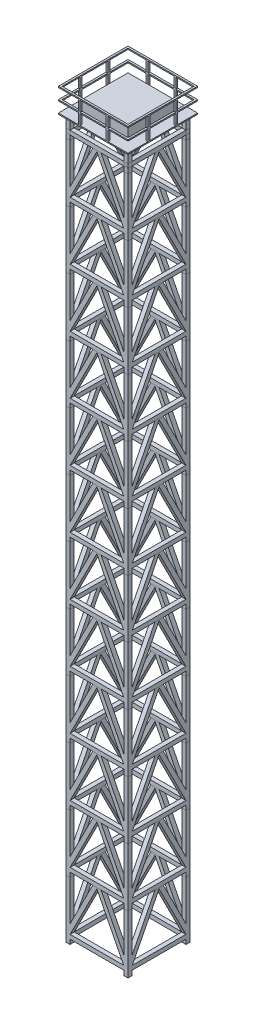
from build123d import *

# Parameters (mm, degrees)
SKETCH1_W                   = 180
SKETCH1_H                   = 180
BOSS_EXTRUDE1_DEPTH         = 2500
SKETCH2_W                   = 180
SKETCH2_H                   = 180
BOSS_EXTRUDE2_DEPTH         = 2320
BOSS_EXTRUDE3_DEPTH         = 180
CIRPATTERN4_COUNT           = 4
LPATTERN1_COUNT             = 12
LPATTERN1_PITCH             = 2500
SKETCH4_W                   = 180
SKETCH4_H                   = 180
BOSS_EXTRUDE4_DEPTH         = 200
SKETCH5_W                   = 2680
SKETCH5_H                   = 180
BOSS_EXTRUDE5_DEPTH         = 180
SKETCH6_W                   = 180
SKETCH6_H                   = 180
BOSS_EXTRUDE6_DEPTH         = 500
CIRPATTERN8_COUNT           = 4
SKETCH7_W                   = 3000
SKETCH7_H                   = 3000
BOSS_EXTRUDE7_DEPTH         = 50
SKETCH8_W                   = 2000
SKETCH8_H                   = 2000
BOSS_EXTRUDE8_DEPTH         = 500
SKETCH9_W                   = 80
SKETCH9_H                   = 80
BOSS_EXTRUDE9_DEPTH         = 1000
SKETCH10_W                  = 80
SKETCH10_H                  = 3000
BOSS_EXTRUDE10_DEPTH        = 50
LPATTERN2_COUNT             = 2
LPATTERN2_PITCH             = 500
CIRPATTERN9_COUNT           = 4
CIRPATTERN9_COPY_1_SKETCH_W = 80
CIRPATTERN9_COPY_1_SKETCH_H = 80
CIRPATTERN9_COPY_1_DEPTH    = 1000
CIRPATTERN9_COPY_2_SKETCH_W = 80
CIRPATTERN9_COPY_2_SKETCH_H = 80
CIRPATTERN9_COPY_2_DEPTH    = 1000
CIRPATTERN9_COPY_3_SKETCH_W = 80
CIRPATTERN9_COPY_3_SKETCH_H = 80
CIRPATTERN9_COPY_3_DEPTH    = 1000
CIRPATTERN9_COPY_4_SKETCH_W = 80
CIRPATTERN9_COPY_4_SKETCH_H = 3000
CIRPATTERN9_COPY_4_DEPTH    = 50
CIRPATTERN9_COPY_5_SKETCH_W = 80
CIRPATTERN9_COPY_5_SKETCH_H = 3000
CIRPATTERN9_COPY_5_DEPTH    = 50
CIRPATTERN9_COPY_6_SKETCH_W = 80
CIRPATTERN9_COPY_6_SKETCH_H = 3000
CIRPATTERN9_COPY_6_DEPTH    = 50


with BuildPart() as part:
    # Sketch1 → Boss-Extrude1 (new body)
    with BuildSketch(Plane(origin=(0, 0, 0), x_dir=(1, 0, 0), z_dir=(0, 1, 0))):
        with Locations((1250, -1250)):
            Rectangle(SKETCH1_W, SKETCH1_H)
    extrude(amount=BOSS_EXTRUDE1_DEPTH)

    # Sketch2 → Boss-Extrude2 (add)
    with BuildSketch(Plane.ZY.offset(-1160)):
        with Locations((1250, 290)):
            Rectangle(SKETCH2_W, SKETCH2_H)
    extrude(amount=BOSS_EXTRUDE2_DEPTH)

    # Sketch3 → Boss-Extrude3 (add)
    with BuildSketch(Plane.XY.offset(1340)):
        Polygon((1181.644275361, 325.25799865), (0, 2656.964152747), (0, 2700), (179.984850938, 2700), (1181.644275361, 723.453002788), align=None)
    boss_extrude3 = extrude(amount=-BOSS_EXTRUDE3_DEPTH)

    # Mirror2: Boss-Extrude3 across plane
    add(boss_extrude3.mirror(Plane(origin=(0, 0, 0), x_dir=(0, 0, 1), z_dir=(1, 0, 0))))


with BuildPart() as cirpattern4_1:
    # CirPattern4: pattern copy
    add(part.part.rotate(Axis((0, 0, 0), (0, 1, 0)), 1 * 360 / CIRPATTERN4_COUNT))


with BuildPart() as cirpattern4_2:
    # CirPattern4: pattern copy
    add(part.part.rotate(Axis((0, 0, 0), (0, 1, 0)), 2 * 360 / CIRPATTERN4_COUNT))


with BuildPart() as cirpattern4_3:
    # CirPattern4: pattern copy
    add(part.part.rotate(Axis((0, 0, 0), (0, 1, 0)), 3 * 360 / CIRPATTERN4_COUNT))


with BuildPart() as part_1:
    add(part.part)

    # Combine1: union CirPattern4_1, CirPattern4_2, CirPattern4_3
    add(cirpattern4_1.part)
    add(cirpattern4_2.part)
    add(cirpattern4_3.part)


with BuildPart() as lpattern1_1:
    # LPattern1: pattern copy
    add(part_1.part.moved(Location(Vector(0, 1, 0) * (1 * LPATTERN1_PITCH))))


with BuildPart() as lpattern1_2:
    # LPattern1: pattern copy
    add(part_1.part.moved(Location(Vector(0, 1, 0) * (2 * LPATTERN1_PITCH))))


with BuildPart() as lpattern1_3:
    # LPattern1: pattern copy
    add(part_1.part.moved(Location(Vector(0, 1, 0) * (3 * LPATTERN1_PITCH))))


with BuildPart() as lpattern1_4:
    # LPattern1: pattern copy
    add(part_1.part.moved(Location(Vector(0, 1, 0) * (4 * LPATTERN1_PITCH))))


with BuildPart() as lpattern1_5:
    # LPattern1: pattern copy
    add(part_1.part.moved(Location(Vector(0, 1, 0) * (5 * LPATTERN1_PITCH))))


with BuildPart() as lpattern1_6:
    # LPattern1: pattern copy
    add(part_1.part.moved(Location(Vector(0, 1, 0) * (6 * LPATTERN1_PITCH))))


with BuildPart() as lpattern1_7:
    # LPattern1: pattern copy
    add(part_1.part.moved(Location(Vector(0, 1, 0) * (7 * LPATTERN1_PITCH))))


with BuildPart() as lpattern1_8:
    # LPattern1: pattern copy
    add(part_1.part.moved(Location(Vector(0, 1, 0) * (8 * LPATTERN1_PITCH))))


with BuildPart() as lpattern1_9:
    # LPattern1: pattern copy
    add(part_1.part.moved(Location(Vector(0, 1, 0) * (9 * LPATTERN1_PITCH))))


with BuildPart() as lpattern1_10:
    # LPattern1: pattern copy
    add(part_1.part.moved(Location(Vector(0, 1, 0) * (10 * LPATTERN1_PITCH))))


with BuildPart() as lpattern1_11:
    # LPattern1: pattern copy
    add(part_1.part.moved(Location(Vector(0, 1, 0) * (11 * LPATTERN1_PITCH))))


with BuildPart() as body_13:
    # Sketch4 → Boss-Extrude4 (new body)
    with BuildSketch(Plane(origin=(0, 30000, 0), x_dir=(1, 0, 0), z_dir=(0, 1, 0))):
        with Locations((1250, -1250)):
            Rectangle(SKETCH4_W, SKETCH4_H)
    extrude(amount=BOSS_EXTRUDE4_DEPTH)


with BuildPart() as body_14:
    # Sketch5 → Boss-Extrude5 (new body)
    with BuildSketch(Plane(origin=(0, 30200, 0), x_dir=(1, 0, 0), z_dir=(0, 1, 0))):
        with Locations((0, -1250)):
            Rectangle(SKETCH5_W, SKETCH5_H)
    extrude(amount=BOSS_EXTRUDE5_DEPTH)


with BuildPart() as body_15:
    # Sketch6 → Boss-Extrude6 (new body)
    with BuildSketch(Plane(origin=(0, 30380, 0), x_dir=(1, 0, 0), z_dir=(0, 1, 0))):
        with Locations((1250, -1250)):
            Rectangle(SKETCH6_W, SKETCH6_H)
    extrude(amount=BOSS_EXTRUDE6_DEPTH)


with BuildPart() as cirpattern8_1:
    # CirPattern8: pattern copy
    add(body_14.part.rotate(Axis((0, 0, 0), (0, 1, 0)), 1 * 360 / CIRPATTERN8_COUNT))


with BuildPart() as cirpattern8_2:
    # CirPattern8: pattern copy
    add(body_14.part.rotate(Axis((0, 0, 0), (0, 1, 0)), 2 * 360 / CIRPATTERN8_COUNT))


with BuildPart() as cirpattern8_3:
    # CirPattern8: pattern copy
    add(body_14.part.rotate(Axis((0, 0, 0), (0, 1, 0)), 3 * 360 / CIRPATTERN8_COUNT))


with BuildPart() as cirpattern8_4:
    # CirPattern8: pattern copy
    add(body_13.part.rotate(Axis((0, 0, 0), (0, 1, 0)), 1 * 360 / CIRPATTERN8_COUNT))


with BuildPart() as cirpattern8_5:
    # CirPattern8: pattern copy
    add(body_13.part.rotate(Axis((0, 0, 0), (0, 1, 0)), 2 * 360 / CIRPATTERN8_COUNT))


with BuildPart() as cirpattern8_6:
    # CirPattern8: pattern copy
    add(body_13.part.rotate(Axis((0, 0, 0), (0, 1, 0)), 3 * 360 / CIRPATTERN8_COUNT))


with BuildPart() as cirpattern8_7:
    # CirPattern8: pattern copy
    add(body_15.part.rotate(Axis((0, 0, 0), (0, 1, 0)), 1 * 360 / CIRPATTERN8_COUNT))


with BuildPart() as cirpattern8_8:
    # CirPattern8: pattern copy
    add(body_15.part.rotate(Axis((0, 0, 0), (0, 1, 0)), 2 * 360 / CIRPATTERN8_COUNT))


with BuildPart() as cirpattern8_9:
    # CirPattern8: pattern copy
    add(body_15.part.rotate(Axis((0, 0, 0), (0, 1, 0)), 3 * 360 / CIRPATTERN8_COUNT))


with BuildPart() as body_15_1:
    add(body_15.part)

    add(cirpattern8_7.part)  # Boss-Extrude7 merges CirPattern8_7

    add(cirpattern8_8.part)  # Boss-Extrude7 merges CirPattern8_8

    add(cirpattern8_9.part)  # Boss-Extrude7 merges CirPattern8_9
    # Sketch7 → Boss-Extrude7 (add)
    with BuildSketch(Plane(origin=(0, 30880, 0), x_dir=(1, 0, 0), z_dir=(0, 1, 0))):
        Rectangle(SKETCH7_W, SKETCH7_H)
    extrude(amount=BOSS_EXTRUDE7_DEPTH)

    # Sketch8 → Boss-Extrude8 (add)
    with BuildSketch(Plane(origin=(0, 30930, 0), x_dir=(1, 0, 0), z_dir=(0, 1, 0))):
        Rectangle(SKETCH8_W, SKETCH8_H)
    extrude(amount=BOSS_EXTRUDE8_DEPTH)

    # Sketch9 → Boss-Extrude9 (add)
    with BuildSketch(Plane(origin=(0, 30930, 0), x_dir=(1, 0, 0), z_dir=(0, 1, 0))):
        with Locations((1460, -600)):
            Rectangle(SKETCH9_W, SKETCH9_H)
    boss_extrude9 = extrude(amount=BOSS_EXTRUDE9_DEPTH)

    # Mirror3: Boss-Extrude9 across plane
    add(boss_extrude9.mirror(Plane.XY))

    # Sketch10 → Boss-Extrude10 (add)
    with BuildSketch(Plane(origin=(0, 31930, 0), x_dir=(1, 0, 0), z_dir=(0, 1, 0))):
        with Locations((1460, 0)):
            Rectangle(SKETCH10_W, SKETCH10_H)
    boss_extrude10 = extrude(amount=-BOSS_EXTRUDE10_DEPTH)

    # LPattern2: Boss-Extrude10 ×2
    with Locations(*[(0, -i * LPATTERN2_PITCH, 0) for i in range(1, LPATTERN2_COUNT)]):
        add(boss_extrude10)

    # CirPattern9: Boss-Extrude9, Boss-Extrude10 ×4 about axis
    cirpattern9_axis = Axis((0, 0, 0), (0, 1, 0))
    add([boss_extrude9.rotate(cirpattern9_axis, i * 360 / CIRPATTERN9_COUNT) for i in range(1, CIRPATTERN9_COUNT)])
    add([boss_extrude10.rotate(cirpattern9_axis, i * 360 / CIRPATTERN9_COUNT) for i in range(1, CIRPATTERN9_COUNT)])

    # CirPattern9 copy 1 sketch → CirPattern9 copy 1 (add)
    with BuildSketch(Plane(origin=(0, 30930, 0), x_dir=(0, 0, -1), z_dir=(0, 1, 0))):
        with Locations((1460, 600)):
            Rectangle(CIRPATTERN9_COPY_1_SKETCH_W, CIRPATTERN9_COPY_1_SKETCH_H)
    extrude(amount=CIRPATTERN9_COPY_1_DEPTH)

    # CirPattern9 copy 2 sketch → CirPattern9 copy 2 (add)
    with BuildSketch(Plane(origin=(0, 30930, 0), x_dir=(-1, 0, 0), z_dir=(0, 1, 0))):
        with Locations((1460, 600)):
            Rectangle(CIRPATTERN9_COPY_2_SKETCH_W, CIRPATTERN9_COPY_2_SKETCH_H)
    extrude(amount=CIRPATTERN9_COPY_2_DEPTH)

    # CirPattern9 copy 3 sketch → CirPattern9 copy 3 (add)
    with BuildSketch(Plane.ZX.offset(30930)):
        with Locations((1460, 600)):
            Rectangle(CIRPATTERN9_COPY_3_SKETCH_W, CIRPATTERN9_COPY_3_SKETCH_H)
    extrude(amount=CIRPATTERN9_COPY_3_DEPTH)

    # CirPattern9 copy 4 sketch → CirPattern9 copy 4 (add)
    with BuildSketch(Plane(origin=(0, 31430, 0), x_dir=(0, 0, -1), z_dir=(0, 1, 0))):
        with Locations((1460, 0)):
            Rectangle(CIRPATTERN9_COPY_4_SKETCH_W, CIRPATTERN9_COPY_4_SKETCH_H)
    extrude(amount=-CIRPATTERN9_COPY_4_DEPTH)

    # CirPattern9 copy 5 sketch → CirPattern9 copy 5 (add)
    with BuildSketch(Plane(origin=(0, 31430, 0), x_dir=(-1, 0, 0), z_dir=(0, 1, 0))):
        with Locations((1460, 0)):
            Rectangle(CIRPATTERN9_COPY_5_SKETCH_W, CIRPATTERN9_COPY_5_SKETCH_H)
    extrude(amount=-CIRPATTERN9_COPY_5_DEPTH)

    # CirPattern9 copy 6 sketch → CirPattern9 copy 6 (add)
    with BuildSketch(Plane.ZX.offset(31430)):
        with Locations((1460, 0)):
            Rectangle(CIRPATTERN9_COPY_6_SKETCH_W, CIRPATTERN9_COPY_6_SKETCH_H)
    extrude(amount=-CIRPATTERN9_COPY_6_DEPTH)


solid = Compound([part_1.part, lpattern1_1.part, lpattern1_2.part, lpattern1_3.part, lpattern1_4.part, lpattern1_5.part, lpattern1_6.part, lpattern1_7.part, lpattern1_8.part, lpattern1_9.part, lpattern1_10.part, lpattern1_11.part, body_13.part, body_14.part, cirpattern8_1.part, cirpattern8_2.part, cirpattern8_3.part, cirpattern8_4.part, cirpattern8_5.part, cirpattern8_6.part, body_15_1.part])
